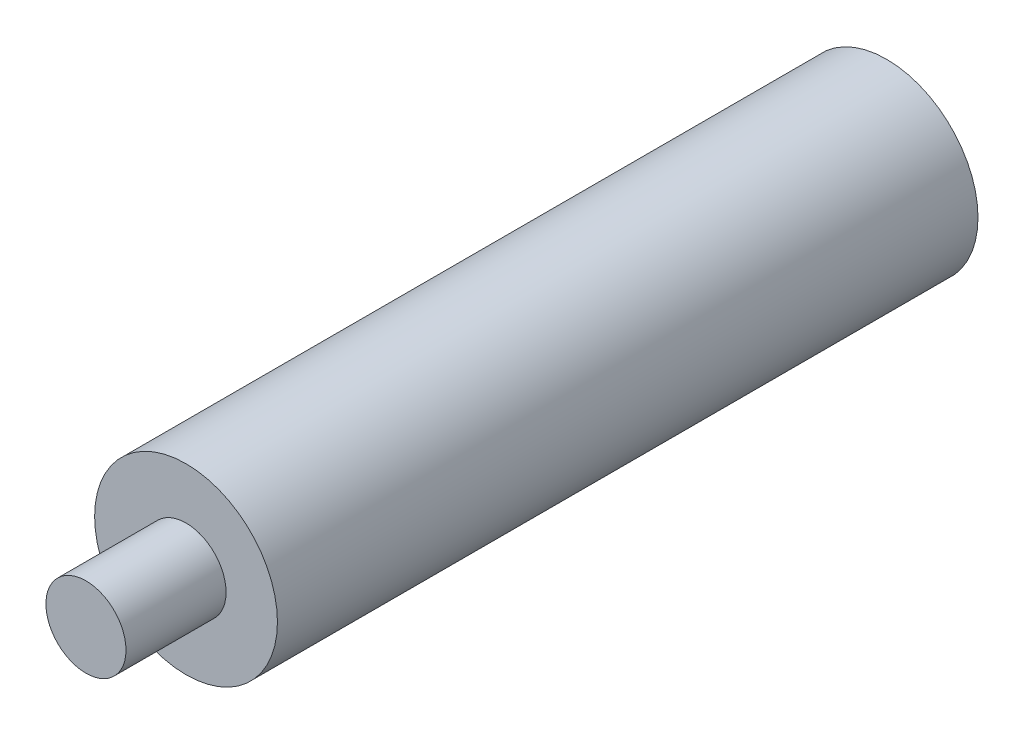
from build123d import *

# Parameters (mm, degrees)
SKETCH_2_R              = 13.7
EXTRUDE_1_DEPTH         = 52.5
SKETCH_3_R              = 6
EXTRUDE_2_DEPTH         = 15
HOLE_WIZARD_M10_1_D     = 8.5
HOLE_WIZARD_M10_1_DEPTH = 27.5
HOLE_WIZARD_M10_1_TIP   = 2.553657631


with BuildPart() as part:
    # 草图2 → 凸台-拉伸1 (new, symmetric)
    with BuildSketch(Plane.XY):
        Circle(SKETCH_2_R)
    extrude(amount=EXTRUDE_1_DEPTH, both=True)

    # 草图3 → 凸台-拉伸2 (add)
    with BuildSketch(Plane.XY.offset(52.5)):
        Circle(SKETCH_3_R)
    extrude(amount=EXTRUDE_2_DEPTH)

    # M10 螺纹孔1
    with Locations(Plane(origin=(0, 0, -52.5), x_dir=(-1, 0, 0), z_dir=(0, 0, -1))):
        with Locations((0, 0)):
            Hole(HOLE_WIZARD_M10_1_D / 2, depth=HOLE_WIZARD_M10_1_DEPTH)
            with Locations((0, 0, -(HOLE_WIZARD_M10_1_DEPTH + HOLE_WIZARD_M10_1_TIP / 2))):  # 118° drill point
                Cone(0, HOLE_WIZARD_M10_1_D / 2, HOLE_WIZARD_M10_1_TIP, mode=Mode.SUBTRACT)


solid = part.part
